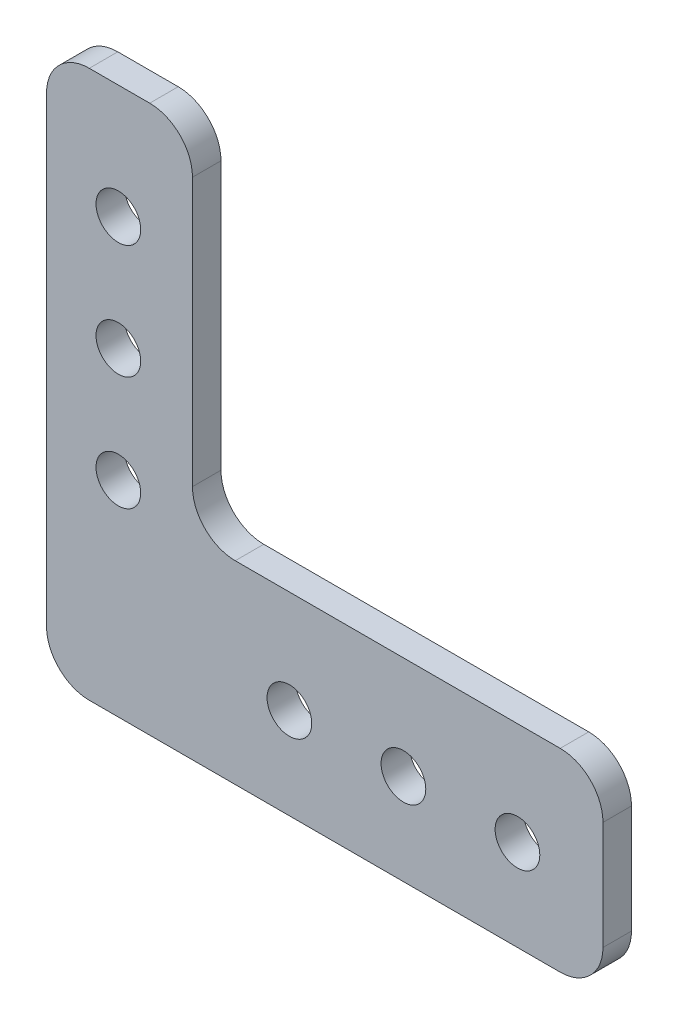
from build123d import *

# Parameters (mm, degrees)
SKETCH1_R           = 2.4892
BOSS_EXTRUDE1_DEPTH = 3.175
FILLET1_R           = 4.7625


with BuildPart() as part:
    # Sketch1 → Boss-Extrude1 (new body)
    with BuildSketch(Plane.XY):
        Polygon((-27.051, 31.75), (-27.051, -29.21), (34.925, -29.21), (34.925, -7.62), (-10.795, -7.62), (-10.795, 31.75), align=None)
        with Locations((-19.05, -6.35)):
            Circle(SKETCH1_R, mode=Mode.SUBTRACT)
        with Locations((0, -19.05)):
            Circle(SKETCH1_R, mode=Mode.SUBTRACT)
        with Locations((12.7, -19.05)):
            Circle(SKETCH1_R, mode=Mode.SUBTRACT)
        with Locations((25.4, -19.05)):
            Circle(SKETCH1_R, mode=Mode.SUBTRACT)
        with Locations((-19.05, 6.35)):
            Circle(SKETCH1_R, mode=Mode.SUBTRACT)
        with Locations((-19.05, 19.05)):
            Circle(SKETCH1_R, mode=Mode.SUBTRACT)
    extrude(amount=BOSS_EXTRUDE1_DEPTH)

    # Fillet1
    fillet1_edges = [part.edges().sort_by_distance(p)[0] for p in [
        (-27.051, 31.75, 1.5875),
        (-10.795, 31.75, 1.5875),
        (-10.795, -7.62, 1.5875),
        (34.925, -7.62, 1.5875),
        (34.925, -29.21, 1.5875),
        (-27.051, -29.21, 1.5875),
    ]]
    fillet(fillet1_edges, radius=FILLET1_R)


solid = part.part
